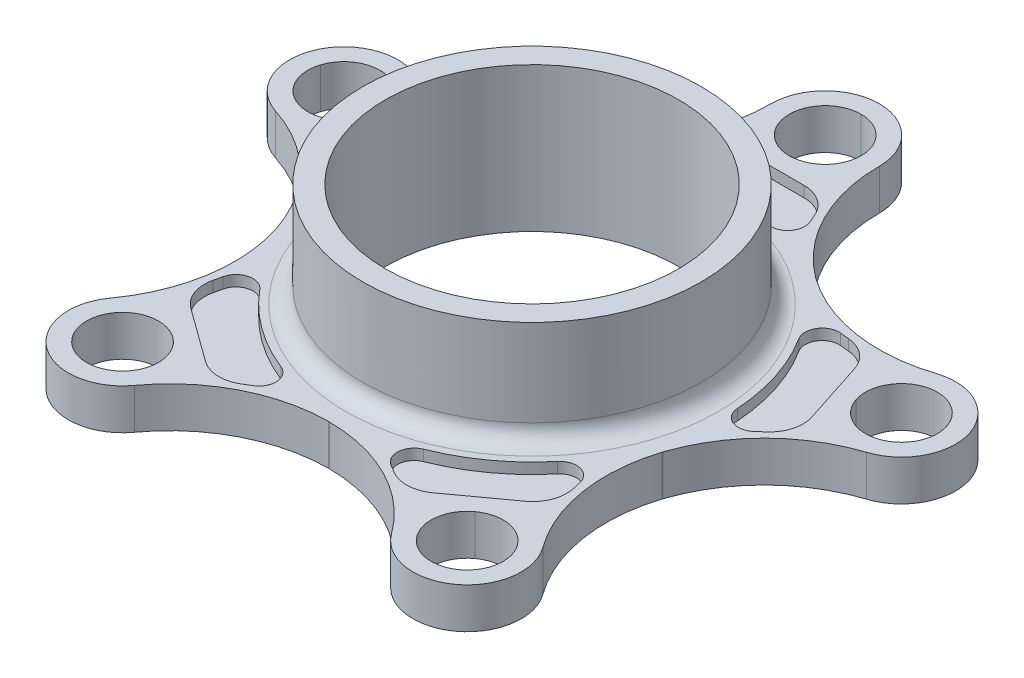
from build123d import *

# Parameters (mm, degrees)
SKETCH1_R                 = 31.75
MIDDLECIRCLEEXTRUDE_DEPTH = 19.4945
SKETCH2_R                 = 80
STARFISHEXTRUDE_DEPTH     = 7.62
SKETCH3_R                 = 27.5
CENTERHOLECUT_DEPTH       = 117.340861739
SKETCH4_R                 = 6.75
OUTERHOLESCUT_DEPTH       = 115.804335851
SKETCH7_OUTSIDE_W         = 207.578
SKETCH7_OUTSIDE_H         = 207.578
STARFISHLEGSCUT_DEPTH     = 115.804335851
WALLFILLET_R              = 3.175
FILLET3_R                 = 12.7
TOPOFFLOORCUT_DEPTH       = 2.032
BOTTOMOFFLOORCUT_DEPTH    = 2.032


with BuildPart() as part:
    # Sketch1 → MiddleCircleExtrude (new body)
    with BuildSketch(Plane(origin=(0, 0, 0), x_dir=(1, 0, 0), z_dir=(0, 1, 0))):
        with Locations(Location((0, 0, 0), (0, 0, 270))):
            Circle(SKETCH1_R)
    extrude(amount=MIDDLECIRCLEEXTRUDE_DEPTH)

    # Sketch2 → StarfishExtrude (add)
    with BuildSketch(Plane.XZ):
        with Locations(Location((0, 0, 0), (0, 0, 90))):
            Circle(SKETCH2_R)
    extrude(amount=STARFISHEXTRUDE_DEPTH)

    # Sketch3 → CenterHoleCut (cut, through all)
    with BuildSketch(Plane(origin=(0, 19.4945, 0), x_dir=(1, 0, 0), z_dir=(0, 1, 0))):
        with Locations(Location((0, 0, 0), (0, 0, 270))):
            Circle(SKETCH3_R)
    extrude(amount=-CENTERHOLECUT_DEPTH, mode=Mode.SUBTRACT)

    # Sketch4 → OuterHolesCut (cut, through all)
    with BuildSketch(Plane(origin=(0, 0, 0), x_dir=(1, 0, 0), z_dir=(0, 1, 0))):
        with Locations(Location((0, 55, 0), (0, 0, 270))):
            Circle(SKETCH4_R)
        with Locations(Location((52.308108396, 16.995934691, 0), (0, 0, 270))):
            Circle(SKETCH4_R)
        with Locations(Location((32.328188876, -44.495934691, 0), (0, 0, 270))):
            Circle(SKETCH4_R)
        with Locations(Location((-32.328188876, -44.495934691, 0), (0, 0, 270))):
            Circle(SKETCH4_R)
        with Locations(Location((-52.308108396, 16.995934691, 0), (0, 0, 270))):
            Circle(SKETCH4_R)
    extrude(amount=-OUTERHOLESCUT_DEPTH, mode=Mode.SUBTRACT)

    # Sketch7 outside → StarfishLegsCut (cut, through all)
    with BuildSketch(Plane(origin=(0, 0, 0), x_dir=(1, 0, 0), z_dir=(0, 1, 0))):
        Rectangle(SKETCH7_OUTSIDE_W, SKETCH7_OUTSIDE_H)
        with BuildLine():
            ThreePointArc((-10.16, 55), (0, 65.16), (10.16, 55))
            ThreePointArc((10.16, 55), (13.39696353, 41.457297616), (22.408117979, 30.842128458))
            ThreePointArc((22.408117979, 30.842128458), (35.288343642, 25.552278968), (49.168495733, 26.658668896))
            ThreePointArc((49.168495733, 26.658668896), (61.970842602, 20.135547353), (55.447721059, 7.333200485))
            ThreePointArc((55.447721059, 7.333200485), (43.568122449, 0.069740041), (36.257096514, -11.780644786))
            ThreePointArc((36.257096514, -11.780644786), (35.206359307, -25.665120724), (40.547801539, -38.524036527))
            ThreePointArc((40.547801539, -38.524036527), (38.300087039, -52.715547353), (24.108576213, -50.467832854))
            ThreePointArc((24.108576213, -50.467832854), (13.52961697, -41.4141959), (0, -38.122967345))
            ThreePointArc((0, -38.122967345), (-13.52961697, -41.4141959), (-24.108576213, -50.467832854))
            ThreePointArc((-24.108576213, -50.467832854), (-38.300087039, -52.715547353), (-40.547801539, -38.524036527))
            ThreePointArc((-40.547801539, -38.524036527), (-35.206359307, -25.665120724), (-36.257096514, -11.780644786))
            ThreePointArc((-36.257096514, -11.780644786), (-43.568122449, 0.069740041), (-55.447721059, 7.333200485))
            ThreePointArc((-55.447721059, 7.333200485), (-61.970842602, 20.135547353), (-49.168495733, 26.658668896))
            ThreePointArc((-49.168495733, 26.658668896), (-35.288343642, 25.552278968), (-22.408117979, 30.842128458))
            ThreePointArc((-22.408117979, 30.842128458), (-13.39696353, 41.457297616), (-10.16, 55))
        make_face(mode=Mode.SUBTRACT)
    extrude(amount=-STARFISHLEGSCUT_DEPTH, mode=Mode.SUBTRACT)

    # WallFillet
    wallfillet_edges = [part.edges().sort_by_distance(p)[0] for p in [
        (0, 0, -31.75),
    ]]
    fillet(wallfillet_edges, radius=WALLFILLET_R)

    # Fillet3
    # the kernel refuses this fillet: 12.7 mm, written as the material it adds along each edge
    with BuildSketch(Plane(origin=(22.408117979, 0, -30.842128458), x_dir=(0.8122286901143284, 0, 0.5833391423135965), z_dir=(0, -1, 0)), Plane(origin=(36.257096514, 0, 11.780644786), x_dir=(-0.30379602394290567, 0, 0.9527370969141914), z_dir=(0, -1, 0)), Plane(origin=(0, 0, 38.122967345), x_dir=(-0.9999849585582664, 0, 0.0054847659222912095), z_dir=(0, -1, 0)), Plane(origin=(-22.408117979, 0, -30.842128458), x_dir=(0.8057809610716475, 0, -0.59221367999604), z_dir=(0, -1, 0))) as fillet3_piece_1:
        with BuildLine():
            CenterArc((0.069657499, -12.699986168), FILLET3_R, 89.915436868, 0.797637293)
            ThreePointArc((-0.088396168, -0.000969708), (-0.044198442, -0.000452238), (0, 0))
            ThreePointArc((0, 0), (0.044200743, 3.2618e-05), (0.088401487, 0))
        make_face()
    extrude(amount=7.62)
    with BuildSketch(Plane(origin=(-36.257096514, 0, 11.780644786), x_dir=(0.3037960239433047, 0, 0.9527370969140643), z_dir=(0, -1, 0))) as fillet3_piece_2:
        with BuildLine():
            CenterArc((0.069657499, 12.699986168), FILLET3_R, 269.286925839, 0.797637293)
            ThreePointArc((-0.088396168, 0.000969708), (-0.044198442, 0.000452238), (0, 0))
            ThreePointArc((0, 0), (0.044200743, -3.2618e-05), (0.088401487, 0))
        make_face()
    extrude(amount=7.62)

    # Sketch14 → TopOfFloorCut (cut)
    with BuildSketch(Plane(origin=(0, 0, 0), x_dir=(1, 0, 0), z_dir=(0, 1, 0))):
        with BuildLine():
            Line((-6.198314337, 44.843951621), (6.198314337, 44.843951621))
            ThreePointArc((6.198314337, 44.843951621), (9.707749909, 43.786055358), (12.047856733, 40.964853026))
            ThreePointArc((12.047856733, 40.964853026), (12.363075296, 40.224323744), (12.682377949, 39.485546257))
            ThreePointArc((12.682377949, 39.485546257), (12.189140226, 36.159889768), (8.984953231, 35.141822863))
            ThreePointArc((8.984953231, 35.141822863), (0, 36.27226349), (-8.984953231, 35.141822863))
            ThreePointArc((-8.984953231, 35.141822863), (-12.189140226, 36.159889768), (-12.682377949, 39.485546257))
            ThreePointArc((-12.682377949, 39.485546257), (-12.363075296, 40.224323744), (-12.047856733, 40.964853026))
            ThreePointArc((-12.047856733, 40.964853026), (-9.707749909, 43.786055358), (-6.198314337, 44.843951621))
        make_face()
        with BuildLine():
            Line((40.733747939, 19.752490386), (44.564516872, 7.962595906))
            ThreePointArc((44.564516872, 7.962595906), (44.64287297, 4.298016412), (42.682882886, 1.200643104))
            ThreePointArc((42.682882886, 1.200643104), (42.076005579, 0.672016303), (41.472056382, 0.140046635))
            ThreePointArc((41.472056382, 0.140046635), (38.15675027, -0.418540787), (36.19836287, 2.314222159))
            ThreePointArc((36.19836287, 2.314222159), (34.496972553, 11.208745843), (30.645356386, 19.404618797))
            ThreePointArc((30.645356386, 19.404618797), (30.623447316, 22.766581694), (33.633915751, 24.263363016))
            ThreePointArc((33.633915751, 24.263363016), (34.435204841, 24.187982945), (35.236897933, 24.11702841))
            ThreePointArc((35.236897933, 24.11702841), (38.643153572, 22.763254032), (40.733747939, 19.752490386))
        make_face()
        with BuildLine():
            Line((31.373155052, -32.6362412), (21.344071783, -39.922796712))
            ThreePointArc((21.344071783, -39.922796712), (17.883062942, -41.129735131), (14.331615628, -40.222814779))
            ThreePointArc((14.331615628, -40.222814779), (13.641326263, -39.808994828), (12.948762478, -39.398992676))
            ThreePointArc((12.948762478, -39.398992676), (11.39302834, -36.418562201), (13.38686536, -33.711554911))
            ThreePointArc((13.38686536, -33.711554911), (21.320301547, -29.344877588), (27.924825075, -23.149108908))
            ThreePointArc((27.924825075, -23.149108908), (31.11547152, -22.089368474), (33.469281058, -24.489963231))
            ThreePointArc((33.469281058, -24.489963231), (33.645202297, -25.275328164), (33.825457314, -26.059709761))
            ThreePointArc((33.825457314, -26.059709761), (33.590532249, -29.717590671), (31.373155052, -32.6362412))
        make_face()
        with BuildLine():
            Line((-21.344071783, -39.922796712), (-31.373155052, -32.6362412))
            ThreePointArc((-31.373155052, -32.6362412), (-33.590532249, -29.717590671), (-33.825457314, -26.059709761))
            ThreePointArc((-33.825457314, -26.059709761), (-33.645202297, -25.275328164), (-33.469281058, -24.489963231))
            ThreePointArc((-33.469281058, -24.489963231), (-31.11547152, -22.089368474), (-27.924825075, -23.149108908))
            ThreePointArc((-27.924825075, -23.149108908), (-21.320301547, -29.344877588), (-13.38686536, -33.711554911))
            ThreePointArc((-13.38686536, -33.711554911), (-11.39302834, -36.418562201), (-12.948762478, -39.398992676))
            ThreePointArc((-12.948762478, -39.398992676), (-13.641326263, -39.808994828), (-14.331615628, -40.222814779))
            ThreePointArc((-14.331615628, -40.222814779), (-17.883062942, -41.129735131), (-21.344071783, -39.922796712))
        make_face()
        with BuildLine():
            Line((-44.564516872, 7.962595906), (-40.733747939, 19.752490386))
            ThreePointArc((-40.733747939, 19.752490386), (-38.643153572, 22.763254032), (-35.236897933, 24.11702841))
            ThreePointArc((-35.236897933, 24.11702841), (-34.435204841, 24.187982945), (-33.633915751, 24.263363016))
            ThreePointArc((-33.633915751, 24.263363016), (-30.623447316, 22.766581694), (-30.645356386, 19.404618797))
            ThreePointArc((-30.645356386, 19.404618797), (-34.496972553, 11.208745843), (-36.19836287, 2.314222159))
            ThreePointArc((-36.19836287, 2.314222159), (-38.15675027, -0.418540787), (-41.472056382, 0.140046635))
            ThreePointArc((-41.472056382, 0.140046635), (-42.076005579, 0.672016303), (-42.682882886, 1.200643104))
            ThreePointArc((-42.682882886, 1.200643104), (-44.64287297, 4.298016412), (-44.564516872, 7.962595906))
        make_face()
    extrude(amount=-TOPOFFLOORCUT_DEPTH, mode=Mode.SUBTRACT)

    # Sketch28 → BottomOfFloorCut (cut)
    with BuildSketch(Plane.XZ.offset(7.62)):
        with BuildLine():
            Line((5.092046835, -44.843951621), (-5.092046835, -44.843951621))
            ThreePointArc((-5.092046835, -44.843951621), (-9.044550431, -43.46388274), (-11.279029707, -39.923546999))
            ThreePointArc((-11.279029707, -39.923546999), (-11.298731959, -39.852466298), (-11.324510142, -39.783356746))
            ThreePointArc((-11.324510142, -39.783356746), (-10.839134599, -36.512766011), (-7.709139054, -35.447176472))
            ThreePointArc((-7.709139054, -35.447176472), (-3.877275098, -36.120184709), (0, -36.440901521))
            ThreePointArc((0, -36.440901521), (3.877275098, -36.120184709), (7.709139054, -35.447176472))
            ThreePointArc((7.709139054, -35.447176472), (10.839134599, -36.512766011), (11.324510142, -39.783356746))
            ThreePointArc((11.324510142, -39.783356746), (11.298731959, -39.852466298), (11.279029707, -39.923546999))
            ThreePointArc((11.279029707, -39.923546999), (9.044550431, -43.46388274), (5.092046835, -44.843951621))
        make_face()
        with BuildLine():
            Line((-41.075603398, -18.700367469), (-44.222661414, -9.014718822))
            ThreePointArc((-44.222661414, -9.014718822), (-44.131528693, -4.829199784), (-41.454961387, -1.610059799))
            ThreePointArc((-41.454961387, -1.610059799), (-41.393447954, -1.569356698), (-41.33568676, -1.523484164))
            ThreePointArc((-41.33568676, -1.523484164), (-38.075180838, -0.974435618), (-36.094523148, -3.621953))
            ThreePointArc((-36.094523148, -3.621953), (-35.550480935, -7.474243167), (-34.657356852, -11.26085786))
            ThreePointArc((-34.657356852, -11.26085786), (-33.15419314, -14.849258663), (-31.330013189, -18.285606865))
            ThreePointArc((-31.330013189, -18.285606865), (-31.376227248, -21.5916948), (-34.336754587, -23.063982492))
            ThreePointArc((-34.336754587, -23.063982492), (-34.410447573, -23.06082201), (-34.484137668, -23.064049198))
            ThreePointArc((-34.484137668, -23.064049198), (-38.541689114, -22.032957032), (-41.075603398, -18.700367469))
        make_face()
        with BuildLine():
            Line((-30.478165843, 33.286488923), (-22.239060992, 39.27254899))
            ThreePointArc((-22.239060992, 39.27254899), (-18.230234277, 40.479273135), (-14.341545433, 38.92847532))
            ThreePointArc((-14.341545433, 38.92847532), (-14.283825788, 38.882550518), (-14.222349225, 38.841791752))
            ThreePointArc((-14.222349225, 38.841791752), (-12.692621287, 35.910531679), (-14.598503059, 33.208686413))
            ThreePointArc((-14.598503059, 33.208686413), (-18.094130436, 31.500848392), (-21.419424495, 29.481308621))
            ThreePointArc((-21.419424495, 29.481308621), (-24.367693329, 26.942838148), (-27.072152073, 24.146049925))
            ThreePointArc((-27.072152073, 24.146049925), (-30.230709476, 23.16836475), (-32.54579154, 25.52903165))
            ThreePointArc((-32.54579154, 25.52903165), (-32.565558127, 25.600094488), (-32.591398858, 25.669180677))
            ThreePointArc((-32.591398858, 25.669180677), (-32.864624287, 29.846766421), (-30.478165843, 33.286488923))
        make_face()
        with BuildLine():
            Line((22.239060992, 39.27254899), (30.478165843, 33.286488923))
            ThreePointArc((30.478165843, 33.286488923), (32.864624287, 29.846766421), (32.591398858, 25.669180677))
            ThreePointArc((32.591398858, 25.669180677), (32.565558127, 25.600094488), (32.54579154, 25.52903165))
            ThreePointArc((32.54579154, 25.52903165), (30.230709476, 23.16836475), (27.072152073, 24.146049925))
            ThreePointArc((27.072152073, 24.146049925), (24.367693329, 26.942838148), (21.419424495, 29.481308621))
            ThreePointArc((21.419424495, 29.481308621), (18.094130436, 31.500848392), (14.598503059, 33.208686413))
            ThreePointArc((14.598503059, 33.208686413), (12.692621287, 35.910531679), (14.222349225, 38.841791752))
            ThreePointArc((14.222349225, 38.841791752), (14.283825788, 38.882550518), (14.341545433, 38.92847532))
            ThreePointArc((14.341545433, 38.92847532), (18.230234277, 40.479273135), (22.239060992, 39.27254899))
        make_face()
        with BuildLine():
            Line((44.222661414, -9.014718822), (41.075603398, -18.700367469))
            ThreePointArc((41.075603398, -18.700367469), (38.541689114, -22.032957032), (34.484137668, -23.064049198))
            ThreePointArc((34.484137668, -23.064049198), (34.410447573, -23.06082201), (34.336754587, -23.063982492))
            ThreePointArc((34.336754587, -23.063982492), (31.376227248, -21.5916948), (31.330013189, -18.285606865))
            ThreePointArc((31.330013189, -18.285606865), (33.15419314, -14.849258663), (34.657356852, -11.26085786))
            ThreePointArc((34.657356852, -11.26085786), (35.550480935, -7.474243167), (36.094523148, -3.621953))
            ThreePointArc((36.094523148, -3.621953), (38.075180838, -0.974435618), (41.33568676, -1.523484164))
            ThreePointArc((41.33568676, -1.523484164), (41.393447954, -1.569356698), (41.454961387, -1.610059799))
            ThreePointArc((41.454961387, -1.610059799), (44.131528693, -4.829199784), (44.222661414, -9.014718822))
        make_face()
    extrude(amount=-BOTTOMOFFLOORCUT_DEPTH, mode=Mode.SUBTRACT)


solid = part.part
